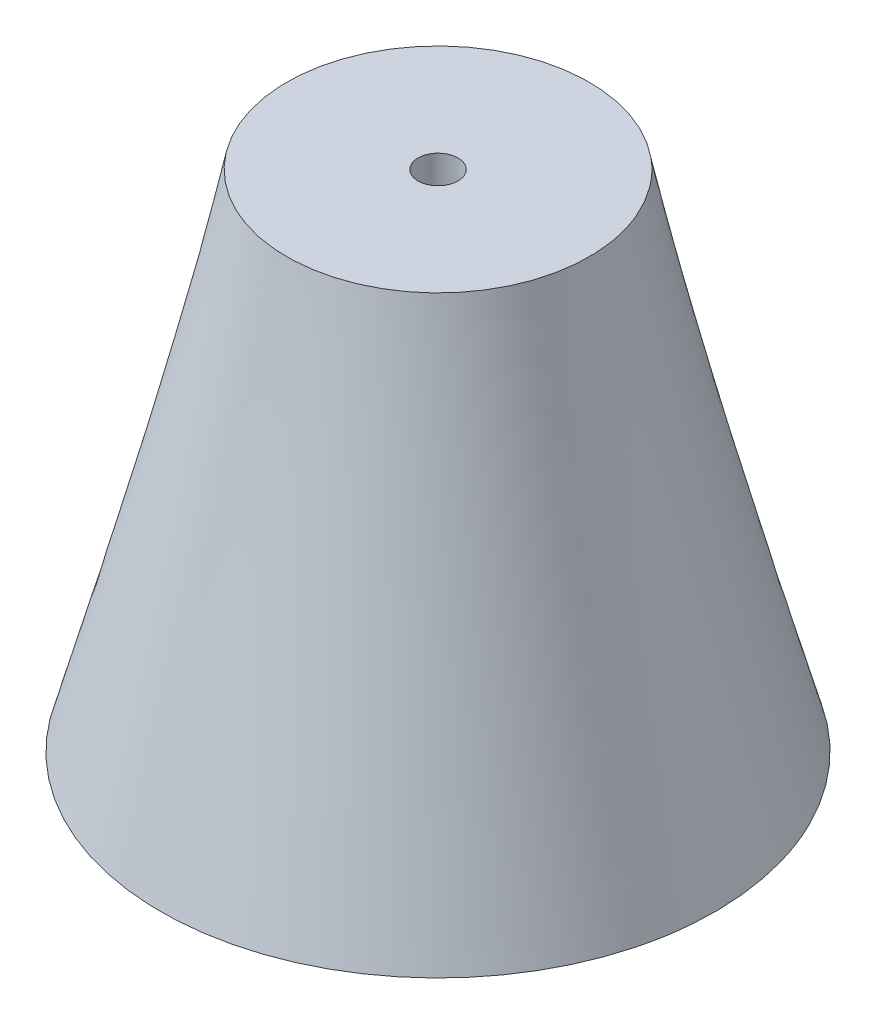
from build123d import *

# Parameters (mm, degrees)
SKETCH15_R         = 1.980191
CUT_EXTRUDE1_DEPTH = 10


with BuildPart() as part:
    # Loft2: read off the stored shape, not the designer's step
    # Loft2: loft between two sections, ruled curve by curve
    loft2_from = [
        Edge.make_bspline([(-27.364599614, 0, 2.725561949), (-21.913475716, 0, 57.454761178), (32.815723513, 0, 52.003637279), (27.364599614, 0, -2.725561949), (21.913475716, 0, -57.454761178), (-32.815723513, 0, -52.003637279), (-27.364599614, 0, 2.725561949)], [0, 0, 0, 0, 0.5, 0.5, 0.5, 1, 1, 1, 1], 3, [1, 0.333333333, 0.333333333, 1, 0.333333333, 0.333333333, 1]),
    ]
    loft2_to = [
        Edge.make_bspline([(-13.015440814, 50, 7.456426786), (1.897412759, 50, 33.487308414), (27.928294387, 50, 18.574454841), (13.015440814, 50, -7.456426786), (-1.897412759, 50, -33.487308414), (-27.928294387, 50, -18.574454841), (-13.015440814, 50, 7.456426786)], [0, 0, 0, 0, 0.5, 0.5, 0.5, 1, 1, 1, 1], 3, [1, 0.333333333, 0.333333333, 1, 0.333333333, 0.333333333, 1]),
    ]
    loft2 = Solid(Shell([*[Face.make_surface_from_curves(loft2_from[k], loft2_to[k]) for k in range(1)], Face(Wire(loft2_from)), Face(Wire(loft2_to))]))
    add(loft2)

    # Sketch15 → Cut-Extrude1 (cut)
    with BuildSketch(Plane(origin=(0, 50, 0), x_dir=(-1, 0, 0), z_dir=(0, -1, 0))):
        with Locations(Location((0, 0, 0), (0, 0, 180))):
            Circle(SKETCH15_R)
    extrude(amount=CUT_EXTRUDE1_DEPTH, mode=Mode.SUBTRACT)


solid = part.part
